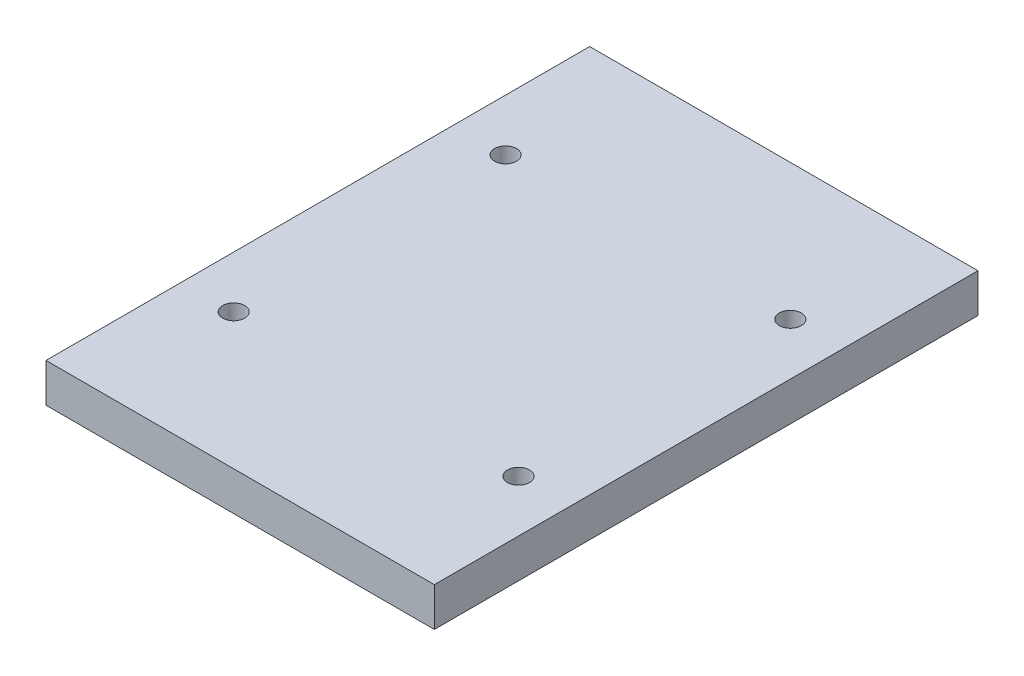
from build123d import *

# Parameters (mm, degrees)
SKETCH1_W           = 60
SKETCH1_H           = 84
RAIL_PLATE_DEPTH    = 6
DOVETAIL_RAIL_DEPTH = 72
SKETCH3_R           = 1.7
M3_HOLES_DEPTH      = 7
SKETCH4_R           = 3
COUNTERBORES_DEPTH  = 4
SKETCH5_R           = 2.25
LOCK_DETENTS_DEPTH  = 2.5


with BuildPart() as part:
    # Sketch1 → Rail Plate (new body)
    with BuildSketch(Plane(origin=(0, -34.4, 0), x_dir=(1, 0, 0), z_dir=(0, 1, 0))):
        with Locations((0, -70)):
            Rectangle(SKETCH1_W, SKETCH1_H)
    extrude(amount=RAIL_PLATE_DEPTH)

    # Sketch2 → Dovetail Rail (add)
    with BuildSketch(Plane.XY.offset(34)):
        Polygon((-14.666666667, -33.9), (14.666666667, -33.9), (19, -40.4), (-19, -40.4), align=None)
    extrude(amount=DOVETAIL_RAIL_DEPTH)

    # Sketch3 → M3 Holes (cut)
    with BuildSketch(Plane(origin=(0, -34.9, 0), x_dir=(1, 0, 0), z_dir=(0, 1, 0))):
        with Locations((-22, -91)):
            Circle(SKETCH3_R)
        with Locations((-22, -49)):
            Circle(SKETCH3_R)
        with Locations((22, -91)):
            Circle(SKETCH3_R)
        with Locations((22, -49)):
            Circle(SKETCH3_R)
    extrude(amount=M3_HOLES_DEPTH, mode=Mode.SUBTRACT)

    # Sketch4 → Counterbores (cut)
    with BuildSketch(Plane(origin=(0, -34.9, 0), x_dir=(1, 0, 0), z_dir=(0, 1, 0))):
        with Locations((-22, -91)):
            Circle(SKETCH4_R)
        with Locations((-22, -49)):
            Circle(SKETCH4_R)
        with Locations((22, -91)):
            Circle(SKETCH4_R)
        with Locations((22, -49)):
            Circle(SKETCH4_R)
    extrude(amount=COUNTERBORES_DEPTH, mode=Mode.SUBTRACT)

    # Sketch5 → Lock Detents (cut)
    with BuildSketch(Plane(origin=(0, -40.9, 0), x_dir=(1, 0, 0), z_dir=(0, 1, 0))):
        with Locations((0, -98)):
            Circle(SKETCH5_R)
        with Locations((0, -42)):
            Circle(SKETCH5_R)
    extrude(amount=LOCK_DETENTS_DEPTH, mode=Mode.SUBTRACT)


solid = part.part
